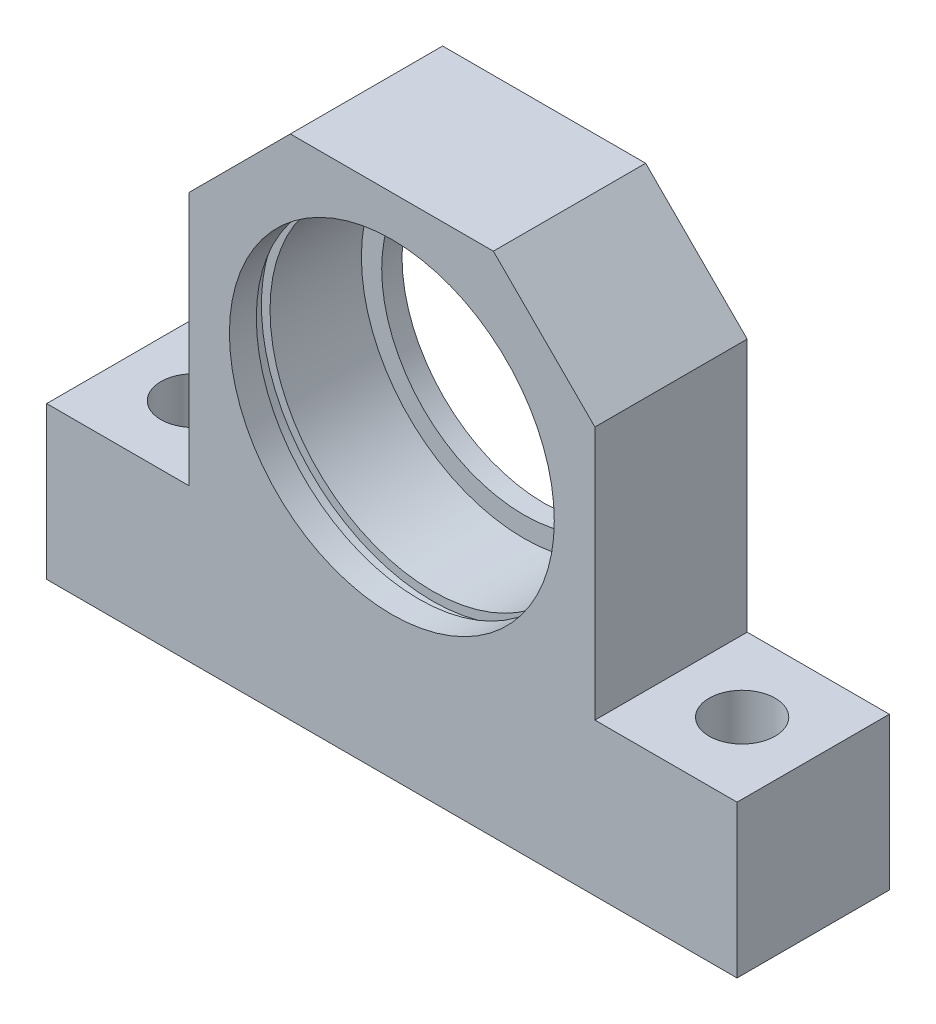
from build123d import *

# Parameters (mm, degrees)
BOSS_EXTRUDE1_DEPTH = 15
DIAMETER_HOLE1_D    = 6.5
CHAMFER1_SIZE       = 10


with BuildPart() as part:
    # Sketch1 → Boss-Extrude1 (new body)
    with BuildSketch(Plane.XY):
        Polygon((-20, 50), (20, 50), (20, 15), (34, 15), (34, 0), (-34, 0), (-34, 15), (-20, 15), align=None)
    extrude(amount=-BOSS_EXTRUDE1_DEPTH)

    # Sketch2 → Cut-Revolve1 (revolve, cut)
    with BuildSketch(Plane(origin=(0, 0, 0), x_dir=(0, 0, -1), z_dir=(1, 0, 0))):
        Polygon((2.65, 46), (2.65, 46.85), (4, 46.85), (4, 46), (13, 46), (13, 44), (15, 44), (15, 30), (0, 30), (0, 46), align=None)
    revolve(axis=Axis((0, 30, -15), (0, 0, 1)), mode=Mode.SUBTRACT)

    # Diameter Hole1 (through all)
    with Locations(Plane(origin=(0, 15, 0), x_dir=(1, 0, 0), z_dir=(0, 1, 0))):
        with Locations((-27, 7.5), (27, 7.5)):
            Hole(DIAMETER_HOLE1_D / 2)

    # Chamfer1
    chamfer1_edges = [part.edges().sort_by_distance(p)[0] for p in [
        (-20, 50, -7.5),
        (20, 50, -7.5),
    ]]
    chamfer(chamfer1_edges, length=CHAMFER1_SIZE)


solid = part.part
